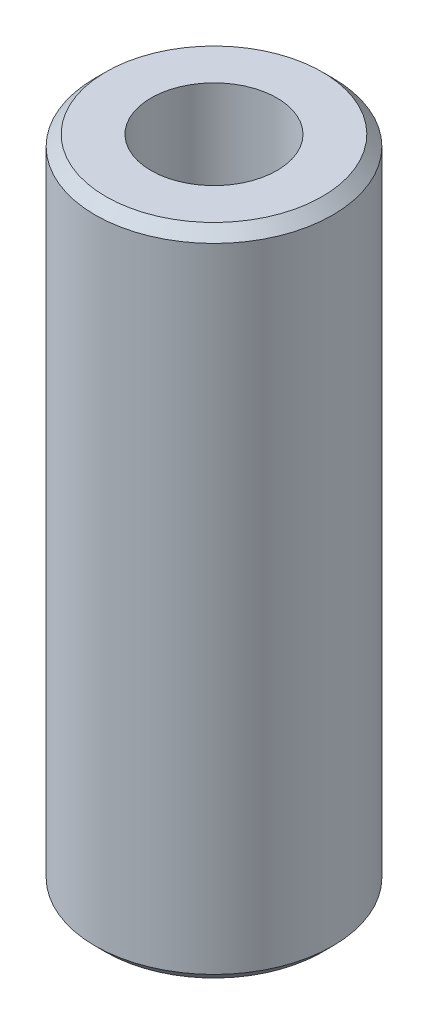
from build123d import *

# Parameters (mm, degrees)
SKETCH1_R           = 45
BOSS_EXTRUDE1_DEPTH = 248.028740991
SKETCH2_R           = 23.862768847
CUT_EXTRUDE1_DEPTH  = 257.062992948
CHAMFER1_SIZE       = 4.032960473


with BuildPart() as part:
    # Sketch1 → Boss-Extrude1 (new body)
    with BuildSketch(Plane(origin=(0, 0, 0), x_dir=(1, 0, 0), z_dir=(0, 1, 0))):
        Circle(SKETCH1_R)
    extrude(amount=BOSS_EXTRUDE1_DEPTH)

    # Sketch2 → Cut-Extrude1 (cut, through all)
    with BuildSketch(Plane(origin=(0, 0, 0), x_dir=(1, 0, 0), z_dir=(0, 1, 0))):
        Circle(SKETCH2_R)
    extrude(amount=CUT_EXTRUDE1_DEPTH, mode=Mode.SUBTRACT)

    # Chamfer1
    chamfer1_edges = [part.edges().sort_by_distance(p)[0] for p in [
        (-45, 248.028740991, 0),
        (-45, 0, 0),
    ]]
    chamfer(chamfer1_edges, length=CHAMFER1_SIZE)


solid = part.part
